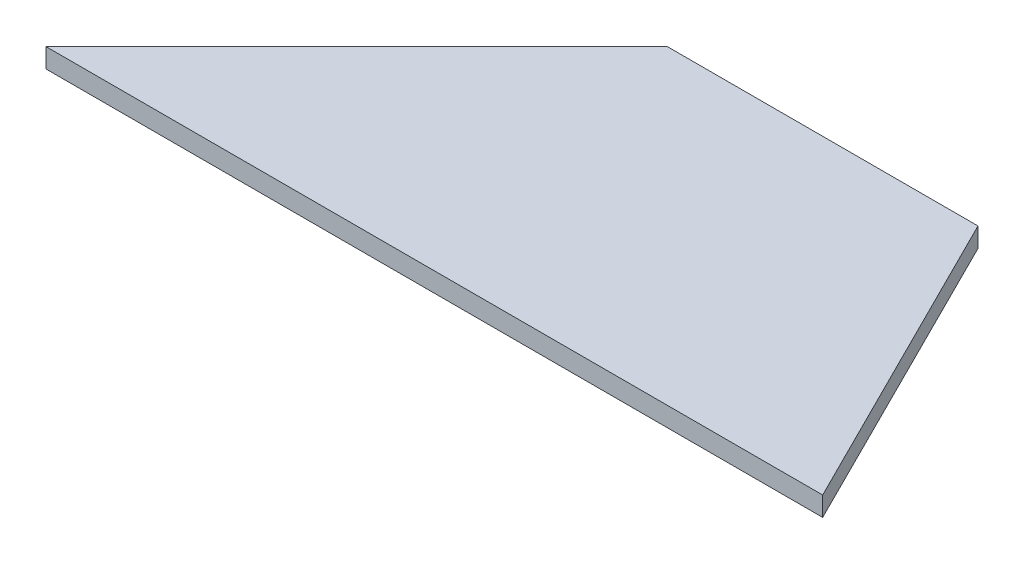
from build123d import *

# Parameters (mm, degrees)
BOSS_EXTRUDE1_DEPTH = 6.35


with BuildPart() as part:
    # Sketch2 → Boss-Extrude1 (new body)
    with BuildSketch(Plane(origin=(0, 0, 0), x_dir=(1, 0, 0), z_dir=(0, 1, 0))):
        Polygon((254, 0), (203.2, 101.6), (101.6, 101.6), (0, 0), align=None)
    extrude(amount=BOSS_EXTRUDE1_DEPTH)


solid = part.part
